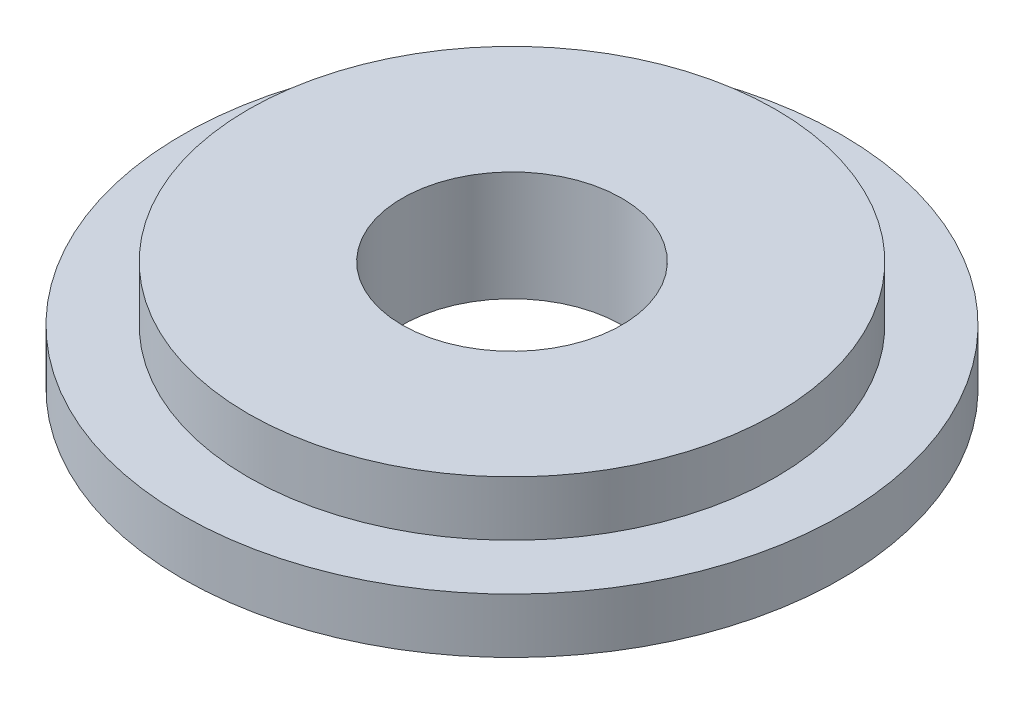
from build123d import *

# Parameters (mm, degrees)
CROQUIS1_R              = 24
CROQUIS1_R_2            = 10
SALIENTE_EXTRUIR1_DEPTH = 5
SALIENTE_EXTRUIR2_START = -5
CROQUIS1_3_R            = 30
CROQUIS1_3_R_2          = 10
SALIENTE_EXTRUIR2_DEPTH = 5


with BuildPart() as part:
    # Croquis1 → Saliente-Extruir1 (new body)
    with BuildSketch(Plane(origin=(0, 0, 0), x_dir=(1, 0, 0), z_dir=(0, 1, 0))):
        Circle(CROQUIS1_R)
        Circle(CROQUIS1_R_2, mode=Mode.SUBTRACT)
    extrude(amount=SALIENTE_EXTRUIR1_DEPTH)

    # Croquis1<3> → Saliente-Extruir2 (add)
    with BuildSketch(Plane(origin=(0, 0, 0), x_dir=(1, 0, 0), z_dir=(0, 1, 0)).offset(SALIENTE_EXTRUIR2_START)):
        Circle(CROQUIS1_3_R)
        Circle(CROQUIS1_3_R_2, mode=Mode.SUBTRACT)
    extrude(amount=SALIENTE_EXTRUIR2_DEPTH)


solid = part.part
